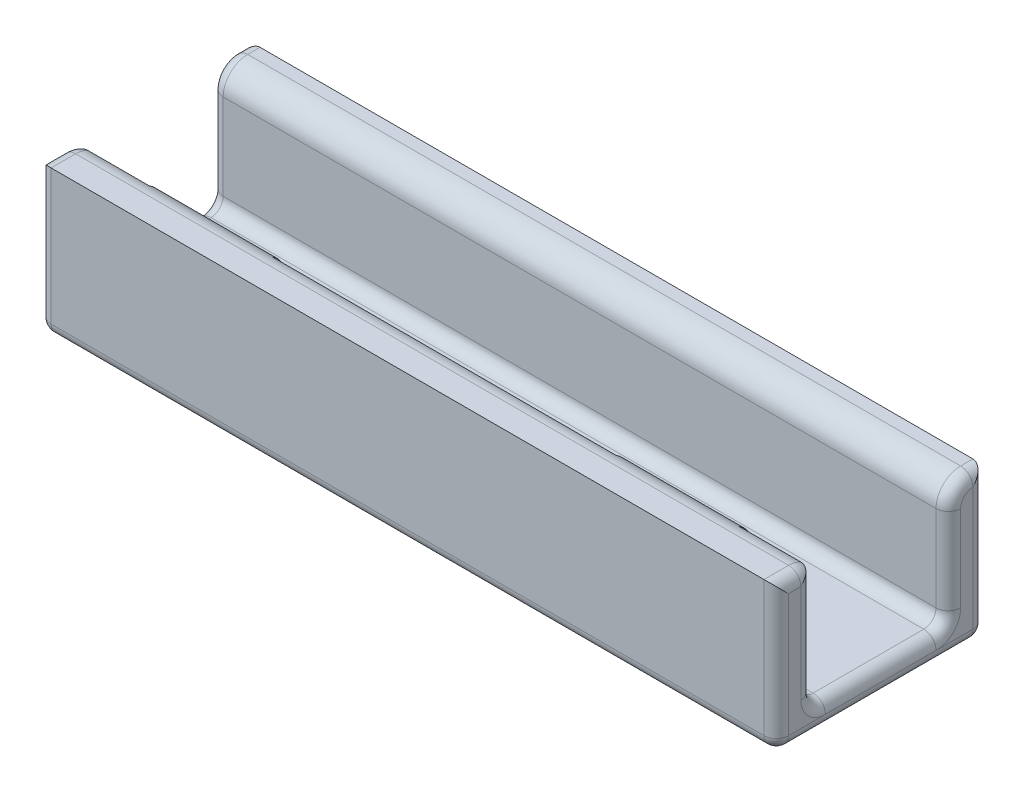
from build123d import *

# Parameters (mm, degrees)
SKETCH2_W           = 60
SKETCH2_H           = 3
SKETCH2_H_2         = 11
BOSS_EXTRUDE2_DEPTH = 2
SKETCH3_W           = 60
SKETCH3_H           = 3
BOSS_EXTRUDE3_DEPTH = 10
SKETCH4_W           = 10
SKETCH4_H           = 2
BOSS_EXTRUDE4_DEPTH = 1
FILLET1_START       = -61
FILLET1_DEPTH       = 62
FILLET2_R           = 1


with BuildPart() as part:
    # Sketch2 → Boss-Extrude2 (new body)
    with BuildSketch(Plane(origin=(0, 0, 0), x_dir=(1, 0, 0), z_dir=(0, 1, 0))):
        with Locations((-30, 1.5)):
            Rectangle(SKETCH2_W, SKETCH2_H)
        with Locations((-30, -5.5)):
            Rectangle(SKETCH2_W, SKETCH2_H_2)
        with Locations((-30, -12.5)):
            Rectangle(SKETCH2_W, SKETCH2_H)
    extrude(amount=BOSS_EXTRUDE2_DEPTH)

    # Sketch3 → Boss-Extrude3 (add)
    with BuildSketch(Plane(origin=(0, 2, 0), x_dir=(1, 0, 0), z_dir=(0, 1, 0))):
        with Locations((-30, -12.5)):
            Rectangle(SKETCH3_W, SKETCH3_H)
        with Locations((-30, 1.5)):
            Rectangle(SKETCH3_W, SKETCH3_H)
    extrude(amount=BOSS_EXTRUDE3_DEPTH)

    # Sketch4 → Boss-Extrude4 (add)
    with BuildSketch(Plane(origin=(0, 0, 11), x_dir=(-1, 0, 0), z_dir=(0, 0, -1))):
        with Locations((49, 11)):
            Rectangle(SKETCH4_W, SKETCH4_H)
        with Locations((11, 11)):
            Rectangle(SKETCH4_W, SKETCH4_H)
    extrude(amount=BOSS_EXTRUDE4_DEPTH)

    # Fillet1: read off the stored shape, not the designer's step
    # Fillet1 outline → Fillet1 (cut)
    with BuildSketch(Plane.YZ.offset(FILLET1_START)):
        with BuildLine():
            Line((12, 0), (10, 0))
            ThreePointArc((10, 0), (11.414213562, -0.585786438), (12, -2))
            Line((12, -2), (12, 0))
        make_face()
        with BuildLine():
            ThreePointArc((12, 12), (11.414213562, 10.585786438), (10, 10))
            Line((10, 10), (12, 10))
            Line((12, 10), (12, 12))
        make_face()
    extrude(amount=FILLET1_DEPTH, mode=Mode.SUBTRACT)

    # Fillet2
    fillet2_edges = [part.edges().sort_by_distance(p)[0] for p in [
        (-60, 6, -3),
        (0, 6, -3),
        (0, 6, 14),
        (-60, 6, 14),
        (-60, 2, 5.5),
        (0, 2, 5.5),
        (0, 12, 13),
        (-30, 2, 11),
        (-30, 2, 0),
        (-60, 12, -2.5),
        (-30, 0, -3),
        (0, 0, 5.5),
        (0, 12, -2.5),
        (0, 6, 0),
        (0, 6.866025404, 11),
        (0, 11.931851652, 11.48236191),
        (0, 11.414213562, -0.585786438),
        (-60, 6, 0),
        (-30, 0, 14),
        (-60, 12, 13),
        (-60, 6.866025404, 11),
        (-60, 11.931851652, 11.48236191),
        (-60, 11.414213562, -0.585786438),
        (-60, 0, 5.5),
    ]]
    fillet(fillet2_edges, radius=FILLET2_R - 0.0001)  # a hair under: the kernel refuses the full size


solid = part.part
